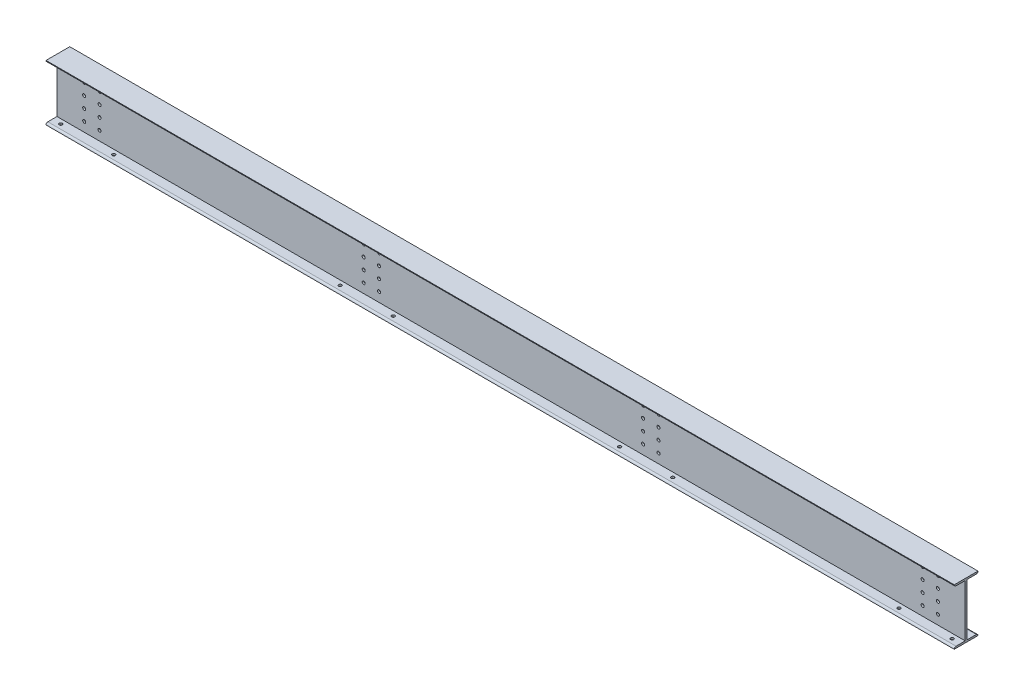
from build123d import *

# Parameters (mm, degrees)
SKETCH_1_W                        = 6500
SKETCH_1_H                        = 400
EXTRUDE_1_DEPTH                   = 170
SKETCH_2_R                        = 11
CUT_EXTRUDE_1_DEPTH               = 6515.514563649
PATTERN_LINEAR_1_COUNT            = 4
PATTERN_LINEAR_1_PITCH            = 80
PATTERN_LINEAR_2_COUNT            = 2
PATTERN_LINEAR_2_PITCH            = 110
PATTERN_LINEAR_2_COPY_1_SKETCH_R  = 11
PATTERN_LINEAR_2_COPY_1_DEPTH     = 6515.514563649
PATTERN_LINEAR_2_COPY_2_SKETCH_R  = 11
PATTERN_LINEAR_2_COPY_2_DEPTH     = 6515.514563649
PATTERN_LINEAR_2_COPY_3_SKETCH_R  = 11
PATTERN_LINEAR_2_COPY_3_DEPTH     = 6515.514563649
PATTERN_LINEAR_3_COUNT            = 4
PATTERN_LINEAR_3_PITCH            = 2000
PATTERN_LINEAR_3_COPY_1_SKETCH_R  = 11
PATTERN_LINEAR_3_COPY_1_DEPTH     = 6515.514563649
PATTERN_LINEAR_3_COPY_2_SKETCH_R  = 11
PATTERN_LINEAR_3_COPY_2_DEPTH     = 6515.514563649
PATTERN_LINEAR_3_COPY_3_SKETCH_R  = 11
PATTERN_LINEAR_3_COPY_3_DEPTH     = 6515.514563649
PATTERN_LINEAR_3_COPY_4_SKETCH_R  = 11
PATTERN_LINEAR_3_COPY_4_DEPTH     = 6515.514563649
PATTERN_LINEAR_3_COPY_5_SKETCH_R  = 11
PATTERN_LINEAR_3_COPY_5_DEPTH     = 6515.514563649
PATTERN_LINEAR_3_COPY_6_SKETCH_R  = 11
PATTERN_LINEAR_3_COPY_6_DEPTH     = 6515.514563649
PATTERN_LINEAR_3_COPY_7_SKETCH_R  = 11
PATTERN_LINEAR_3_COPY_7_DEPTH     = 6515.514563649
PATTERN_LINEAR_3_COPY_8_SKETCH_R  = 11
PATTERN_LINEAR_3_COPY_8_DEPTH     = 6515.514563649
PATTERN_LINEAR_3_COPY_9_SKETCH_R  = 11
PATTERN_LINEAR_3_COPY_9_DEPTH     = 6515.514563649
PATTERN_LINEAR_3_COPY_10_SKETCH_R = 11
PATTERN_LINEAR_3_COPY_10_DEPTH    = 6515.514563649
PATTERN_LINEAR_3_COPY_11_SKETCH_R = 11
PATTERN_LINEAR_3_COPY_11_DEPTH    = 6515.514563649
PATTERN_LINEAR_3_COPY_12_SKETCH_R = 11
PATTERN_LINEAR_3_COPY_12_DEPTH    = 6515.514563649
PATTERN_LINEAR_3_COPY_13_SKETCH_R = 11
PATTERN_LINEAR_3_COPY_13_DEPTH    = 6515.514563649
PATTERN_LINEAR_3_COPY_14_SKETCH_R = 11
PATTERN_LINEAR_3_COPY_14_DEPTH    = 6515.514563649
PATTERN_LINEAR_3_COPY_15_SKETCH_R = 11
PATTERN_LINEAR_3_COPY_15_DEPTH    = 6515.514563649
PATTERN_LINEAR_3_COPY_16_SKETCH_R = 11
PATTERN_LINEAR_3_COPY_16_DEPTH    = 6515.514563649
PATTERN_LINEAR_3_COPY_17_SKETCH_R = 11
PATTERN_LINEAR_3_COPY_17_DEPTH    = 6515.514563649
PATTERN_LINEAR_3_COPY_18_SKETCH_R = 11
PATTERN_LINEAR_3_COPY_18_DEPTH    = 6515.514563649
PATTERN_LINEAR_3_COPY_19_SKETCH_R = 11
PATTERN_LINEAR_3_COPY_19_DEPTH    = 6515.514563649
PATTERN_LINEAR_3_COPY_20_SKETCH_R = 11
PATTERN_LINEAR_3_COPY_20_DEPTH    = 6515.514563649
PATTERN_LINEAR_3_COPY_21_SKETCH_R = 11
PATTERN_LINEAR_3_COPY_21_DEPTH    = 6515.514563649
SKETCH_3_R                        = 11
CUT_EXTRUDE_2_DEPTH               = 200
PATTERN_LINEAR_4_COUNT            = 2
PATTERN_LINEAR_4_PITCH            = 80
PATTERN_LINEAR_5_COUNT            = 2
PATTERN_LINEAR_5_PITCH            = 380
PATTERN_LINEAR_5_COPY_1_SKETCH_R  = 11
PATTERN_LINEAR_5_COPY_1_DEPTH     = 200
PATTERN_LINEAR_6_COUNT            = 4
PATTERN_LINEAR_6_PITCH            = 2000
PATTERN_LINEAR_6_COPY_1_SKETCH_R  = 11
PATTERN_LINEAR_6_COPY_1_DEPTH     = 200
PATTERN_LINEAR_6_COPY_2_SKETCH_R  = 11
PATTERN_LINEAR_6_COPY_2_DEPTH     = 200
PATTERN_LINEAR_6_COPY_3_SKETCH_R  = 11
PATTERN_LINEAR_6_COPY_3_DEPTH     = 200
PATTERN_LINEAR_6_COPY_4_SKETCH_R  = 11
PATTERN_LINEAR_6_COPY_4_DEPTH     = 200
PATTERN_LINEAR_6_COPY_5_SKETCH_R  = 11
PATTERN_LINEAR_6_COPY_5_DEPTH     = 200
PATTERN_LINEAR_6_COPY_6_SKETCH_R  = 11
PATTERN_LINEAR_6_COPY_6_DEPTH     = 200
PATTERN_LINEAR_6_COPY_7_SKETCH_R  = 11
PATTERN_LINEAR_6_COPY_7_DEPTH     = 200
PATTERN_LINEAR_6_COPY_8_SKETCH_R  = 11
PATTERN_LINEAR_6_COPY_8_DEPTH     = 200
PATTERN_LINEAR_6_COPY_9_SKETCH_R  = 11
PATTERN_LINEAR_6_COPY_9_DEPTH     = 200
SKETCH_5_W                        = 78.5
SKETCH_5_H                        = 374
CUT_EXTRUDE_3_DEPTH               = 6515.514563649
FILLET_1_R                        = 13
FILLET_2_R                        = 13
FILLET_3_R                        = 13
FILLET_4_R                        = 13


with BuildPart() as part:
    # 草图1 → 拉伸1 (new body)
    with BuildSketch(Plane.XY):
        with Locations((3250, 200)):
            Rectangle(SKETCH_1_W, SKETCH_1_H)
    extrude(amount=EXTRUDE_1_DEPTH)

    # 草图2 → 切除-拉伸1 (cut, through all)
    with BuildSketch(Plane.XY.offset(170)):
        with Locations((195, 80)):
            Circle(SKETCH_2_R)
    cut_extrude_1 = extrude(amount=-CUT_EXTRUDE_1_DEPTH, mode=Mode.SUBTRACT)

    # 阵列(线性)1: 切除-拉伸1 ×4
    with Locations(*[(0, i * PATTERN_LINEAR_1_PITCH, 0) for i in range(1, PATTERN_LINEAR_1_COUNT)]):
        add(cut_extrude_1, mode=Mode.SUBTRACT)

    # 阵列(线性)2: 切除-拉伸1 ×2
    with Locations(*[(i * PATTERN_LINEAR_2_PITCH, 0, 0) for i in range(1, PATTERN_LINEAR_2_COUNT)]):
        add(cut_extrude_1, mode=Mode.SUBTRACT)

    # 阵列(线性)2 copy 1 sketch → 阵列(线性)2 copy 1 (cut, through all)
    with BuildSketch(Plane(origin=(110, 80, 170), x_dir=(1, 0, 0), z_dir=(0, 0, 1))):
        with Locations((195, 80)):
            Circle(PATTERN_LINEAR_2_COPY_1_SKETCH_R)
    extrude(amount=-PATTERN_LINEAR_2_COPY_1_DEPTH, mode=Mode.SUBTRACT)

    # 阵列(线性)2 copy 2 sketch → 阵列(线性)2 copy 2 (cut, through all)
    with BuildSketch(Plane(origin=(110, 160, 170), x_dir=(1, 0, 0), z_dir=(0, 0, 1))):
        with Locations((195, 80)):
            Circle(PATTERN_LINEAR_2_COPY_2_SKETCH_R)
    extrude(amount=-PATTERN_LINEAR_2_COPY_2_DEPTH, mode=Mode.SUBTRACT)

    # 阵列(线性)2 copy 3 sketch → 阵列(线性)2 copy 3 (cut, through all)
    with BuildSketch(Plane(origin=(110, 240, 170), x_dir=(1, 0, 0), z_dir=(0, 0, 1))):
        with Locations((195, 80)):
            Circle(PATTERN_LINEAR_2_COPY_3_SKETCH_R)
    extrude(amount=-PATTERN_LINEAR_2_COPY_3_DEPTH, mode=Mode.SUBTRACT)

    # 阵列(线性)3: 切除-拉伸1 ×4
    with Locations(*[(i * PATTERN_LINEAR_3_PITCH, 0, 0) for i in range(1, PATTERN_LINEAR_3_COUNT)]):
        add(cut_extrude_1, mode=Mode.SUBTRACT)

    # 阵列(线性)3 copy 1 sketch → 阵列(线性)3 copy 1 (cut, through all)
    with BuildSketch(Plane(origin=(2000, 80, 170), x_dir=(1, 0, 0), z_dir=(0, 0, 1))):
        with Locations((195, 80)):
            Circle(PATTERN_LINEAR_3_COPY_1_SKETCH_R)
    extrude(amount=-PATTERN_LINEAR_3_COPY_1_DEPTH, mode=Mode.SUBTRACT)

    # 阵列(线性)3 copy 2 sketch → 阵列(线性)3 copy 2 (cut, through all)
    with BuildSketch(Plane(origin=(4000, 80, 170), x_dir=(1, 0, 0), z_dir=(0, 0, 1))):
        with Locations((195, 80)):
            Circle(PATTERN_LINEAR_3_COPY_2_SKETCH_R)
    extrude(amount=-PATTERN_LINEAR_3_COPY_2_DEPTH, mode=Mode.SUBTRACT)

    # 阵列(线性)3 copy 3 sketch → 阵列(线性)3 copy 3 (cut, through all)
    with BuildSketch(Plane(origin=(6000, 80, 170), x_dir=(1, 0, 0), z_dir=(0, 0, 1))):
        with Locations((195, 80)):
            Circle(PATTERN_LINEAR_3_COPY_3_SKETCH_R)
    extrude(amount=-PATTERN_LINEAR_3_COPY_3_DEPTH, mode=Mode.SUBTRACT)

    # 阵列(线性)3 copy 4 sketch → 阵列(线性)3 copy 4 (cut, through all)
    with BuildSketch(Plane(origin=(2000, 160, 170), x_dir=(1, 0, 0), z_dir=(0, 0, 1))):
        with Locations((195, 80)):
            Circle(PATTERN_LINEAR_3_COPY_4_SKETCH_R)
    extrude(amount=-PATTERN_LINEAR_3_COPY_4_DEPTH, mode=Mode.SUBTRACT)

    # 阵列(线性)3 copy 5 sketch → 阵列(线性)3 copy 5 (cut, through all)
    with BuildSketch(Plane(origin=(4000, 160, 170), x_dir=(1, 0, 0), z_dir=(0, 0, 1))):
        with Locations((195, 80)):
            Circle(PATTERN_LINEAR_3_COPY_5_SKETCH_R)
    extrude(amount=-PATTERN_LINEAR_3_COPY_5_DEPTH, mode=Mode.SUBTRACT)

    # 阵列(线性)3 copy 6 sketch → 阵列(线性)3 copy 6 (cut, through all)
    with BuildSketch(Plane(origin=(6000, 160, 170), x_dir=(1, 0, 0), z_dir=(0, 0, 1))):
        with Locations((195, 80)):
            Circle(PATTERN_LINEAR_3_COPY_6_SKETCH_R)
    extrude(amount=-PATTERN_LINEAR_3_COPY_6_DEPTH, mode=Mode.SUBTRACT)

    # 阵列(线性)3 copy 7 sketch → 阵列(线性)3 copy 7 (cut, through all)
    with BuildSketch(Plane(origin=(2000, 240, 170), x_dir=(1, 0, 0), z_dir=(0, 0, 1))):
        with Locations((195, 80)):
            Circle(PATTERN_LINEAR_3_COPY_7_SKETCH_R)
    extrude(amount=-PATTERN_LINEAR_3_COPY_7_DEPTH, mode=Mode.SUBTRACT)

    # 阵列(线性)3 copy 8 sketch → 阵列(线性)3 copy 8 (cut, through all)
    with BuildSketch(Plane(origin=(4000, 240, 170), x_dir=(1, 0, 0), z_dir=(0, 0, 1))):
        with Locations((195, 80)):
            Circle(PATTERN_LINEAR_3_COPY_8_SKETCH_R)
    extrude(amount=-PATTERN_LINEAR_3_COPY_8_DEPTH, mode=Mode.SUBTRACT)

    # 阵列(线性)3 copy 9 sketch → 阵列(线性)3 copy 9 (cut, through all)
    with BuildSketch(Plane(origin=(6000, 240, 170), x_dir=(1, 0, 0), z_dir=(0, 0, 1))):
        with Locations((195, 80)):
            Circle(PATTERN_LINEAR_3_COPY_9_SKETCH_R)
    extrude(amount=-PATTERN_LINEAR_3_COPY_9_DEPTH, mode=Mode.SUBTRACT)

    # 阵列(线性)3 copy 10 sketch → 阵列(线性)3 copy 10 (cut, through all)
    with BuildSketch(Plane(origin=(2110, 0, 170), x_dir=(1, 0, 0), z_dir=(0, 0, 1))):
        with Locations((195, 80)):
            Circle(PATTERN_LINEAR_3_COPY_10_SKETCH_R)
    extrude(amount=-PATTERN_LINEAR_3_COPY_10_DEPTH, mode=Mode.SUBTRACT)

    # 阵列(线性)3 copy 11 sketch → 阵列(线性)3 copy 11 (cut, through all)
    with BuildSketch(Plane(origin=(4110, 0, 170), x_dir=(1, 0, 0), z_dir=(0, 0, 1))):
        with Locations((195, 80)):
            Circle(PATTERN_LINEAR_3_COPY_11_SKETCH_R)
    extrude(amount=-PATTERN_LINEAR_3_COPY_11_DEPTH, mode=Mode.SUBTRACT)

    # 阵列(线性)3 copy 12 sketch → 阵列(线性)3 copy 12 (cut, through all)
    with BuildSketch(Plane(origin=(6110, 0, 170), x_dir=(1, 0, 0), z_dir=(0, 0, 1))):
        with Locations((195, 80)):
            Circle(PATTERN_LINEAR_3_COPY_12_SKETCH_R)
    extrude(amount=-PATTERN_LINEAR_3_COPY_12_DEPTH, mode=Mode.SUBTRACT)

    # 阵列(线性)3 copy 13 sketch → 阵列(线性)3 copy 13 (cut, through all)
    with BuildSketch(Plane(origin=(2110, 80, 170), x_dir=(1, 0, 0), z_dir=(0, 0, 1))):
        with Locations((195, 80)):
            Circle(PATTERN_LINEAR_3_COPY_13_SKETCH_R)
    extrude(amount=-PATTERN_LINEAR_3_COPY_13_DEPTH, mode=Mode.SUBTRACT)

    # 阵列(线性)3 copy 14 sketch → 阵列(线性)3 copy 14 (cut, through all)
    with BuildSketch(Plane(origin=(4110, 80, 170), x_dir=(1, 0, 0), z_dir=(0, 0, 1))):
        with Locations((195, 80)):
            Circle(PATTERN_LINEAR_3_COPY_14_SKETCH_R)
    extrude(amount=-PATTERN_LINEAR_3_COPY_14_DEPTH, mode=Mode.SUBTRACT)

    # 阵列(线性)3 copy 15 sketch → 阵列(线性)3 copy 15 (cut, through all)
    with BuildSketch(Plane(origin=(6110, 80, 170), x_dir=(1, 0, 0), z_dir=(0, 0, 1))):
        with Locations((195, 80)):
            Circle(PATTERN_LINEAR_3_COPY_15_SKETCH_R)
    extrude(amount=-PATTERN_LINEAR_3_COPY_15_DEPTH, mode=Mode.SUBTRACT)

    # 阵列(线性)3 copy 16 sketch → 阵列(线性)3 copy 16 (cut, through all)
    with BuildSketch(Plane(origin=(2110, 160, 170), x_dir=(1, 0, 0), z_dir=(0, 0, 1))):
        with Locations((195, 80)):
            Circle(PATTERN_LINEAR_3_COPY_16_SKETCH_R)
    extrude(amount=-PATTERN_LINEAR_3_COPY_16_DEPTH, mode=Mode.SUBTRACT)

    # 阵列(线性)3 copy 17 sketch → 阵列(线性)3 copy 17 (cut, through all)
    with BuildSketch(Plane(origin=(4110, 160, 170), x_dir=(1, 0, 0), z_dir=(0, 0, 1))):
        with Locations((195, 80)):
            Circle(PATTERN_LINEAR_3_COPY_17_SKETCH_R)
    extrude(amount=-PATTERN_LINEAR_3_COPY_17_DEPTH, mode=Mode.SUBTRACT)

    # 阵列(线性)3 copy 18 sketch → 阵列(线性)3 copy 18 (cut, through all)
    with BuildSketch(Plane(origin=(6110, 160, 170), x_dir=(1, 0, 0), z_dir=(0, 0, 1))):
        with Locations((195, 80)):
            Circle(PATTERN_LINEAR_3_COPY_18_SKETCH_R)
    extrude(amount=-PATTERN_LINEAR_3_COPY_18_DEPTH, mode=Mode.SUBTRACT)

    # 阵列(线性)3 copy 19 sketch → 阵列(线性)3 copy 19 (cut, through all)
    with BuildSketch(Plane(origin=(2110, 240, 170), x_dir=(1, 0, 0), z_dir=(0, 0, 1))):
        with Locations((195, 80)):
            Circle(PATTERN_LINEAR_3_COPY_19_SKETCH_R)
    extrude(amount=-PATTERN_LINEAR_3_COPY_19_DEPTH, mode=Mode.SUBTRACT)

    # 阵列(线性)3 copy 20 sketch → 阵列(线性)3 copy 20 (cut, through all)
    with BuildSketch(Plane(origin=(4110, 240, 170), x_dir=(1, 0, 0), z_dir=(0, 0, 1))):
        with Locations((195, 80)):
            Circle(PATTERN_LINEAR_3_COPY_20_SKETCH_R)
    extrude(amount=-PATTERN_LINEAR_3_COPY_20_DEPTH, mode=Mode.SUBTRACT)

    # 阵列(线性)3 copy 21 sketch → 阵列(线性)3 copy 21 (cut, through all)
    with BuildSketch(Plane(origin=(6110, 240, 170), x_dir=(1, 0, 0), z_dir=(0, 0, 1))):
        with Locations((195, 80)):
            Circle(PATTERN_LINEAR_3_COPY_21_SKETCH_R)
    extrude(amount=-PATTERN_LINEAR_3_COPY_21_DEPTH, mode=Mode.SUBTRACT)

    # 草图3 → 切除-拉伸2 (cut)
    with BuildSketch(Plane.XZ):
        with Locations(Location((60, 45, 0), (0, 0, 270))):
            Circle(SKETCH_3_R)
    cut_extrude_2 = extrude(amount=-CUT_EXTRUDE_2_DEPTH, mode=Mode.SUBTRACT)

    # 阵列(线性)4: 切除-拉伸2 ×2
    with Locations(*[(0, 0, i * PATTERN_LINEAR_4_PITCH) for i in range(1, PATTERN_LINEAR_4_COUNT)]):
        add(cut_extrude_2, mode=Mode.SUBTRACT)

    # 阵列(线性)5: 切除-拉伸2 ×2
    with Locations(*[(i * PATTERN_LINEAR_5_PITCH, 0, 0) for i in range(1, PATTERN_LINEAR_5_COUNT)]):
        add(cut_extrude_2, mode=Mode.SUBTRACT)

    # 阵列(线性)5 copy 1 sketch → 阵列(线性)5 copy 1 (cut)
    with BuildSketch(Plane(origin=(380, 0, 80), x_dir=(1, 0, 0), z_dir=(0, -1, 0))):
        with Locations(Location((60, 45, 0), (0, 0, 270))):
            Circle(PATTERN_LINEAR_5_COPY_1_SKETCH_R)
    extrude(amount=-PATTERN_LINEAR_5_COPY_1_DEPTH, mode=Mode.SUBTRACT)

    # 阵列(线性)6: 切除-拉伸2 ×4
    with Locations(*[(i * PATTERN_LINEAR_6_PITCH, 0, 0) for i in range(1, PATTERN_LINEAR_6_COUNT)]):
        add(cut_extrude_2, mode=Mode.SUBTRACT)

    # 阵列(线性)6 copy 1 sketch → 阵列(线性)6 copy 1 (cut)
    with BuildSketch(Plane(origin=(2000, 0, 80), x_dir=(1, 0, 0), z_dir=(0, -1, 0))):
        with Locations(Location((60, 45, 0), (0, 0, 270))):
            Circle(PATTERN_LINEAR_6_COPY_1_SKETCH_R)
    extrude(amount=-PATTERN_LINEAR_6_COPY_1_DEPTH, mode=Mode.SUBTRACT)

    # 阵列(线性)6 copy 2 sketch → 阵列(线性)6 copy 2 (cut)
    with BuildSketch(Plane(origin=(4000, 0, 80), x_dir=(1, 0, 0), z_dir=(0, -1, 0))):
        with Locations(Location((60, 45, 0), (0, 0, 270))):
            Circle(PATTERN_LINEAR_6_COPY_2_SKETCH_R)
    extrude(amount=-PATTERN_LINEAR_6_COPY_2_DEPTH, mode=Mode.SUBTRACT)

    # 阵列(线性)6 copy 3 sketch → 阵列(线性)6 copy 3 (cut)
    with BuildSketch(Plane(origin=(6000, 0, 80), x_dir=(1, 0, 0), z_dir=(0, -1, 0))):
        with Locations(Location((60, 45, 0), (0, 0, 270))):
            Circle(PATTERN_LINEAR_6_COPY_3_SKETCH_R)
    extrude(amount=-PATTERN_LINEAR_6_COPY_3_DEPTH, mode=Mode.SUBTRACT)

    # 阵列(线性)6 copy 4 sketch → 阵列(线性)6 copy 4 (cut)
    with BuildSketch(Plane(origin=(2380, 0, 0), x_dir=(1, 0, 0), z_dir=(0, -1, 0))):
        with Locations(Location((60, 45, 0), (0, 0, 270))):
            Circle(PATTERN_LINEAR_6_COPY_4_SKETCH_R)
    extrude(amount=-PATTERN_LINEAR_6_COPY_4_DEPTH, mode=Mode.SUBTRACT)

    # 阵列(线性)6 copy 5 sketch → 阵列(线性)6 copy 5 (cut)
    with BuildSketch(Plane(origin=(4380, 0, 0), x_dir=(1, 0, 0), z_dir=(0, -1, 0))):
        with Locations(Location((60, 45, 0), (0, 0, 270))):
            Circle(PATTERN_LINEAR_6_COPY_5_SKETCH_R)
    extrude(amount=-PATTERN_LINEAR_6_COPY_5_DEPTH, mode=Mode.SUBTRACT)

    # 阵列(线性)6 copy 6 sketch → 阵列(线性)6 copy 6 (cut)
    with BuildSketch(Plane(origin=(6380, 0, 0), x_dir=(1, 0, 0), z_dir=(0, -1, 0))):
        with Locations(Location((60, 45, 0), (0, 0, 270))):
            Circle(PATTERN_LINEAR_6_COPY_6_SKETCH_R)
    extrude(amount=-PATTERN_LINEAR_6_COPY_6_DEPTH, mode=Mode.SUBTRACT)

    # 阵列(线性)6 copy 7 sketch → 阵列(线性)6 copy 7 (cut)
    with BuildSketch(Plane(origin=(2380, 0, 80), x_dir=(1, 0, 0), z_dir=(0, -1, 0))):
        with Locations(Location((60, 45, 0), (0, 0, 270))):
            Circle(PATTERN_LINEAR_6_COPY_7_SKETCH_R)
    extrude(amount=-PATTERN_LINEAR_6_COPY_7_DEPTH, mode=Mode.SUBTRACT)

    # 阵列(线性)6 copy 8 sketch → 阵列(线性)6 copy 8 (cut)
    with BuildSketch(Plane(origin=(4380, 0, 80), x_dir=(1, 0, 0), z_dir=(0, -1, 0))):
        with Locations(Location((60, 45, 0), (0, 0, 270))):
            Circle(PATTERN_LINEAR_6_COPY_8_SKETCH_R)
    extrude(amount=-PATTERN_LINEAR_6_COPY_8_DEPTH, mode=Mode.SUBTRACT)

    # 阵列(线性)6 copy 9 sketch → 阵列(线性)6 copy 9 (cut)
    with BuildSketch(Plane(origin=(6380, 0, 80), x_dir=(1, 0, 0), z_dir=(0, -1, 0))):
        with Locations(Location((60, 45, 0), (0, 0, 270))):
            Circle(PATTERN_LINEAR_6_COPY_9_SKETCH_R)
    extrude(amount=-PATTERN_LINEAR_6_COPY_9_DEPTH, mode=Mode.SUBTRACT)

    # 草图5 → 切除-拉伸3 (cut, through all)
    with BuildSketch(Plane.ZY):
        with Locations((39.25, 200)):
            Rectangle(SKETCH_5_W, SKETCH_5_H)
        with Locations((130.75, 200)):
            Rectangle(SKETCH_5_W, SKETCH_5_H)
    extrude(amount=-CUT_EXTRUDE_3_DEPTH, mode=Mode.SUBTRACT)

    # 圆角1
    fillet_1_edges = [part.edges().sort_by_distance(p)[0] for p in [
        (3250, 13, 170),
    ]]
    fillet(fillet_1_edges, radius=FILLET_1_R - 0.0001)  # a hair under: the kernel refuses the full size

    # 圆角2
    fillet_2_edges = [part.edges().sort_by_distance(p)[0] for p in [
        (3250, 387, 170),
    ]]
    fillet(fillet_2_edges, radius=FILLET_2_R - 0.0001)  # a hair under: the kernel refuses the full size

    # 圆角3
    fillet_3_edges = [part.edges().sort_by_distance(p)[0] for p in [
        (3250, 13, 0),
    ]]
    fillet(fillet_3_edges, radius=FILLET_3_R - 0.0001)  # a hair under: the kernel refuses the full size

    # 圆角4
    fillet_4_edges = [part.edges().sort_by_distance(p)[0] for p in [
        (3250, 387, 0),
    ]]
    fillet(fillet_4_edges, radius=FILLET_4_R - 0.0001)  # a hair under: the kernel refuses the full size


solid = part.part
